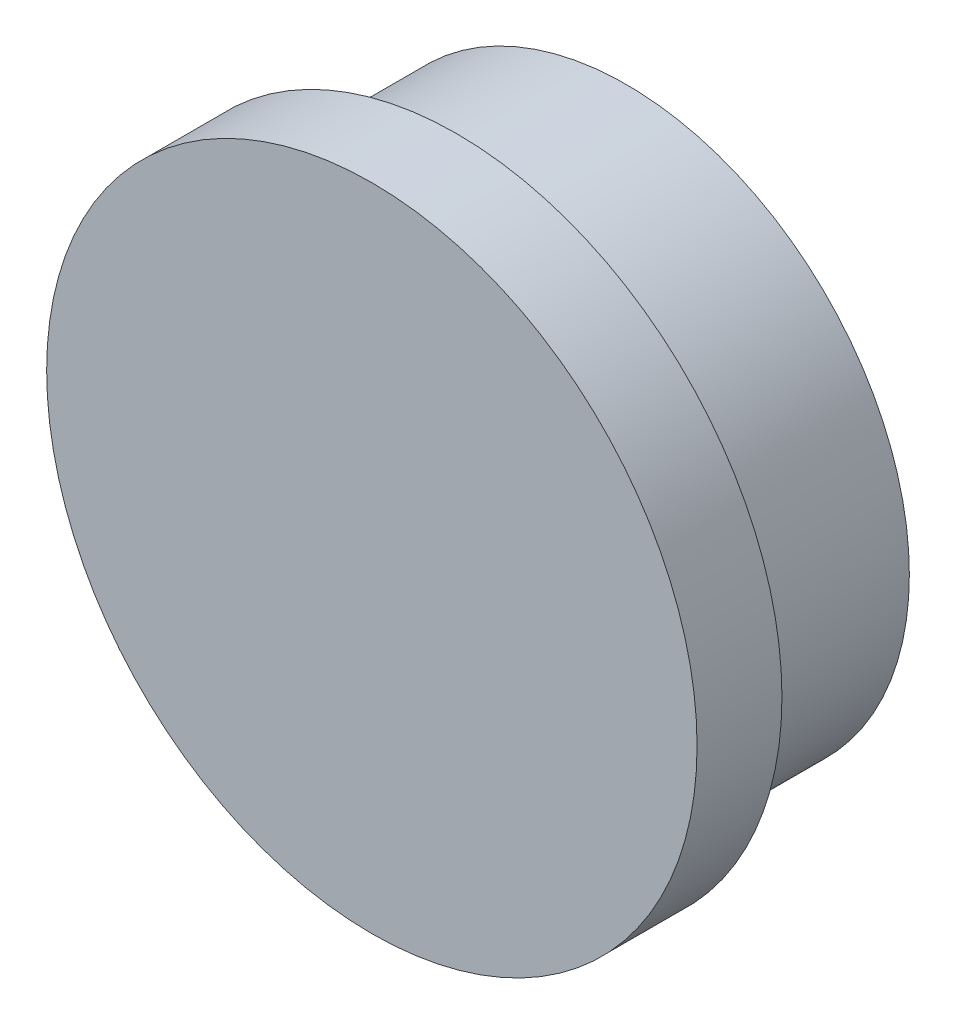
from build123d import *

# Parameters (mm, degrees)
SKETCH1_R           = 11.496197946
BOSS_EXTRUDE1_DEPTH = 3
SKETCH2_R           = 10
BOSS_EXTRUDE2_DEPTH = 6
SKETCH3_R           = 1.5
CUT_EXTRUDE1_DEPTH  = 5


with BuildPart() as part:
    # Sketch1 → Boss-Extrude1 (new body)
    with BuildSketch(Plane.XY):
        with Locations((-127.992538975, 40.103259291)):
            Circle(SKETCH1_R)
    extrude(amount=BOSS_EXTRUDE1_DEPTH)

    # Sketch2 → Boss-Extrude2 (add)
    with BuildSketch(Plane(origin=(0, 0, 0), x_dir=(-1, 0, 0), z_dir=(0, 0, -1))):
        with Locations((127.992538975, 40.103259291)):
            Circle(SKETCH2_R)
    extrude(amount=BOSS_EXTRUDE2_DEPTH)

    # Sketch3 → Cut-Extrude1 (cut)
    with BuildSketch(Plane(origin=(0, 0, -6), x_dir=(-1, 0, 0), z_dir=(0, 0, -1))):
        with Locations((127.992538975, 40.103259291)):
            Circle(SKETCH3_R)
    extrude(amount=-CUT_EXTRUDE1_DEPTH, mode=Mode.SUBTRACT)


solid = part.part
